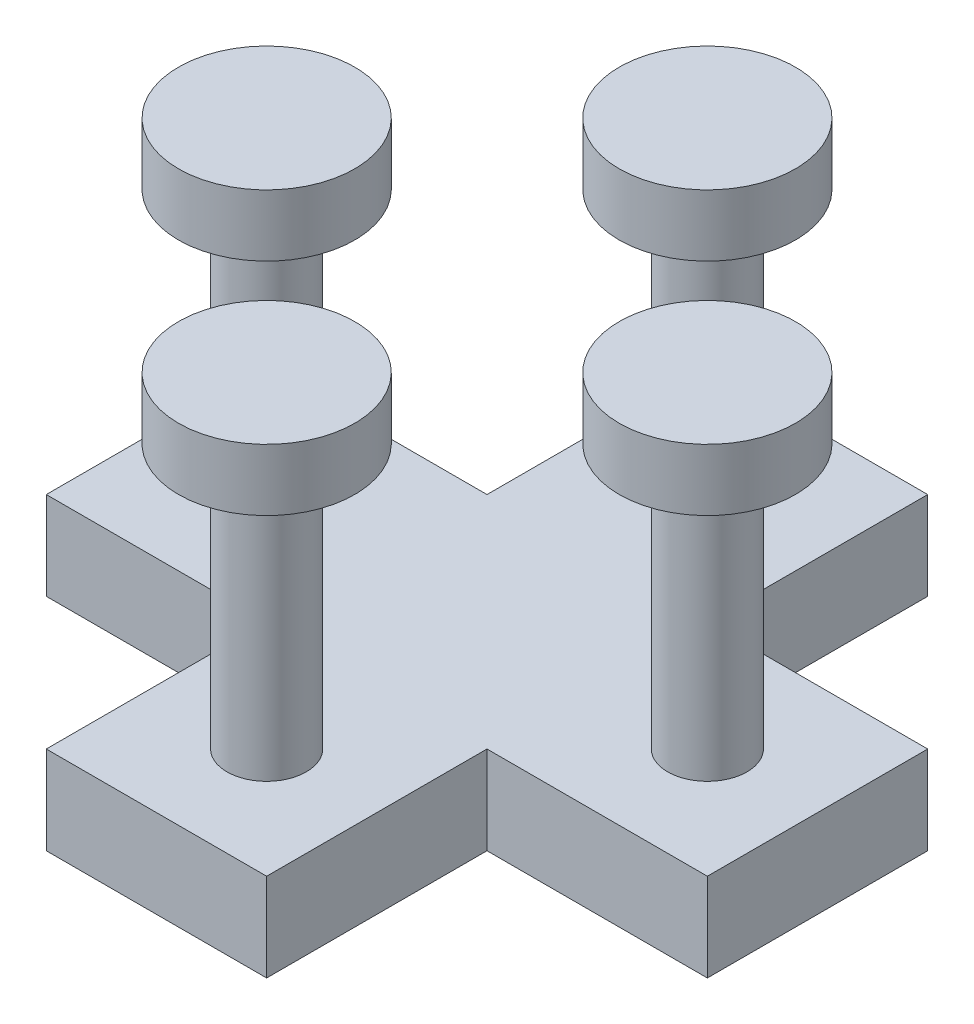
from build123d import *

# Parameters (mm, degrees)
BODY_DEPTH = 2.54
SKETCH2_R  = 1.143
FLAG_DEPTH = 7.62
SKETCH3_R  = 2.54
FEET_DEPTH = 1.778


with BuildPart() as part:
    # Sketch1 → body (new body)
    with BuildSketch(Plane(origin=(0, 0, 0), x_dir=(1, 0, 0), z_dir=(0, 1, 0))):
        Polygon((-8.348684361, -10.452067183), (-8.348684361, -4.102067183), (-1.998684361, -4.102067183), (-1.998684361, -10.452067183), (4.351315639, -10.452067183), (4.351315639, -16.802067183), (-1.998684361, -16.802067183), (-1.998684361, -23.152067183), (-8.348684361, -23.152067183), (-8.348684361, -16.802067183), (-14.698684361, -16.802067183), (-14.698684361, -10.452067183), align=None)
    extrude(amount=BODY_DEPTH)

    # Sketch2 → flag (add)
    with BuildSketch(Plane(origin=(0, 2.54, 0), x_dir=(1, 0, 0), z_dir=(0, 1, 0))):
        with Locations((-5.173684361, -7.277067183)):
            Circle(SKETCH2_R)
        with Locations((1.176315639, -13.627067183)):
            Circle(SKETCH2_R)
        with Locations((-5.173684361, -19.977067183)):
            Circle(SKETCH2_R)
        with Locations((-11.523684361, -13.627067183)):
            Circle(SKETCH2_R)
    extrude(amount=FLAG_DEPTH)

    # Sketch3 → feet (add)
    with BuildSketch(Plane(origin=(0, 10.16, 0), x_dir=(1, 0, 0), z_dir=(0, 1, 0))):
        with Locations((-5.173684361, -7.277067183)):
            Circle(SKETCH3_R)
        with Locations((-11.523684361, -13.627067183)):
            Circle(SKETCH3_R)
        with Locations((-5.173684361, -19.977067183)):
            Circle(SKETCH3_R)
        with Locations((1.176315639, -13.627067183)):
            Circle(SKETCH3_R)
    extrude(amount=FEET_DEPTH)


solid = part.part
